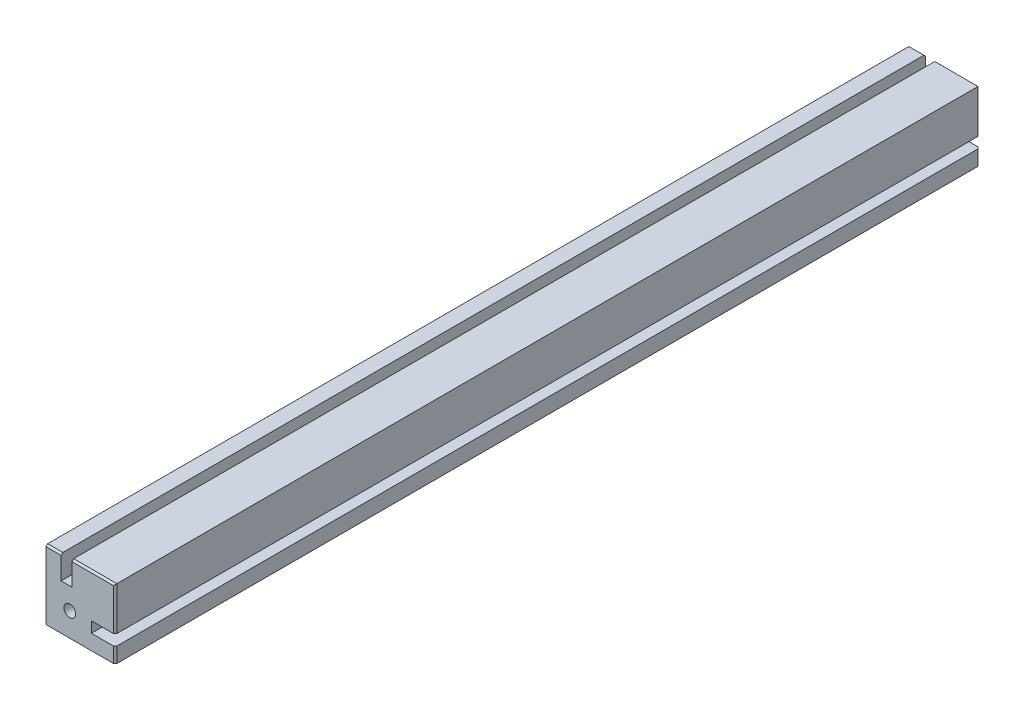
from build123d import *

# Parameters (mm, degrees)
ESQUISSE1_W                      = 16
ESQUISSE1_H                      = 16
BOSS_EXTRU_1_DEPTH               = 200
ESQUISSE2_W                      = 2.5
ESQUISSE2_H                      = 5.5
ESQUISSE2_W_2                    = 5.5
ESQUISSE2_H_2                    = 2.5
ENL_V_MAT_EXTRU_1_DEPTH          = 201.319744409
CHANFREIN1_SIZE                  = 0.4
D_GAGEMENT_M2_51_D               = 2.7
D_GAGEMENT_M2_51_DEPTH           = 14.188838164
D_GAGEMENT_M2_51_TIP             = 0.811161836
D_GAGEMENT_M2_51_ON_FACE_2_D     = 2.7
D_GAGEMENT_M2_51_ON_FACE_2_DEPTH = 14.188838164
D_GAGEMENT_M2_51_ON_FACE_2_TIP   = 0.811161836


with BuildPart() as part:
    # Esquisse1 → Boss.-Extru.1 (new body)
    with BuildSketch(Plane.XY):
        Rectangle(ESQUISSE1_W, ESQUISSE1_H)
    extrude(amount=BOSS_EXTRU_1_DEPTH)

    # Esquisse2 → Enlèv. mat.-Extru.1 (cut, through all)
    with BuildSketch(Plane.XY.offset(200)):
        with Locations((-3.25, 5.25)):
            Rectangle(ESQUISSE2_W, ESQUISSE2_H)
        with Locations((5.25, -3.25)):
            Rectangle(ESQUISSE2_W_2, ESQUISSE2_H_2)
    extrude(amount=-ENL_V_MAT_EXTRU_1_DEPTH, mode=Mode.SUBTRACT)

    # Chanfrein1
    chanfrein1_edges = [part.edges().sort_by_distance(p)[0] for p in [
        (8, -6.25, 200),
        (8, 3, 200),
        (3, 8, 200),
        (-6.25, 8, 200),
        (8, -6.25, 0),
        (8, 3, 0),
        (-6.25, 8, 0),
        (3, 8, 0),
    ]]
    chamfer(chanfrein1_edges, length=CHANFREIN1_SIZE)

    # Dégagement M2.51
    with Locations(Plane(origin=(-2.5, -2.5, 200), x_dir=(1, 0, 0), z_dir=(0, 0, 1))):
        with Locations((0, 0)):
            Hole(D_GAGEMENT_M2_51_D / 2, depth=D_GAGEMENT_M2_51_DEPTH)
            with Locations((0, 0, -(D_GAGEMENT_M2_51_DEPTH + D_GAGEMENT_M2_51_TIP / 2))):  # 118° drill point
                Cone(0, D_GAGEMENT_M2_51_D / 2, D_GAGEMENT_M2_51_TIP, mode=Mode.SUBTRACT)

    # Dégagement M2.51 on face 2
    with Locations(Plane(origin=(-2.5, -2.5, 0), x_dir=(-1, 0, 0), z_dir=(0, 0, -1))):
        with Locations((0, 0)):
            Hole(D_GAGEMENT_M2_51_ON_FACE_2_D / 2, depth=D_GAGEMENT_M2_51_ON_FACE_2_DEPTH)
            with Locations((0, 0, -(D_GAGEMENT_M2_51_ON_FACE_2_DEPTH + D_GAGEMENT_M2_51_ON_FACE_2_TIP / 2))):  # 118° drill point
                Cone(0, D_GAGEMENT_M2_51_ON_FACE_2_D / 2, D_GAGEMENT_M2_51_ON_FACE_2_TIP, mode=Mode.SUBTRACT)


solid = part.part
